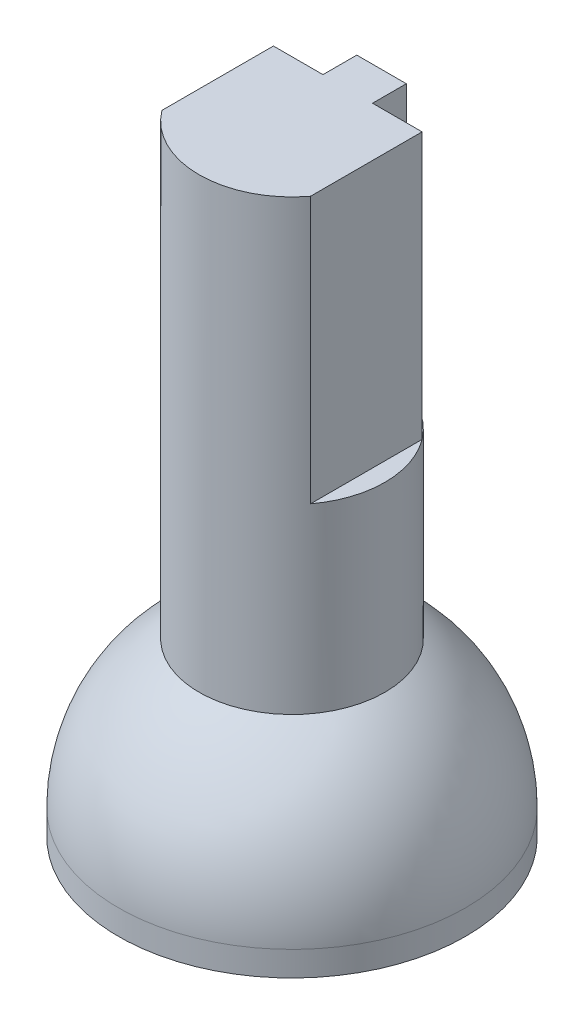
from build123d import *

# Parameters (mm, degrees)
CUT_EXTRUDE1_DEPTH = 5.461


with BuildPart() as part:
    # Sketch3 → Revolve1 (revolve)
    with BuildSketch(Plane.XY):
        with BuildLine():
            Line((0, 12.192), (-1.905, 12.192))
            Line((-1.905, 12.192), (-1.905, 3.002683966))
            ThreePointArc((-1.905, 3.002683966), (-3.116032413, 1.713323671), (-3.556, 0))
            Line((-3.556, 0), (-3.556, -0.508))
            Line((-3.556, -0.508), (-3.226233304, -0.508))
            Line((-3.226233304, -0.508), (-2.199704526, 1.27))
            ThreePointArc((-2.199704526, 1.27), (-1.796051224, 1.796051224), (-1.27, 2.199704526))
            Line((-1.27, 2.199704526), (0, 2.932939367))
            Line((0, 2.932939367), (0, 12.192))
        make_face()
    revolve(axis=Axis((0, 12.192, 0), (0, -1, 0)))

    # Sketch4 → Cut-Extrude1 (cut)
    with BuildSketch(Plane(origin=(0, 12.192, 0), x_dir=(1, 0, 0), z_dir=(0, 1, 0))):
        Polygon((1.524, -1.905), (3.172103448, -1.905), (3.172103448, 1.905), (1.524, 1.905), (1.524, 3.070311556), (-1.524, 3.070311556), (-1.524, 1.905), (-3.172103448, 1.905), (-3.172103448, -1.905), (-1.524, -1.905), (-1.524, 1.143), (-0.508, 1.143), (-0.508, 1.836017701), (0.508, 1.836017701), (0.508, 1.143), (1.524, 1.143), align=None)
    extrude(amount=-CUT_EXTRUDE1_DEPTH, mode=Mode.SUBTRACT)


solid = part.part
